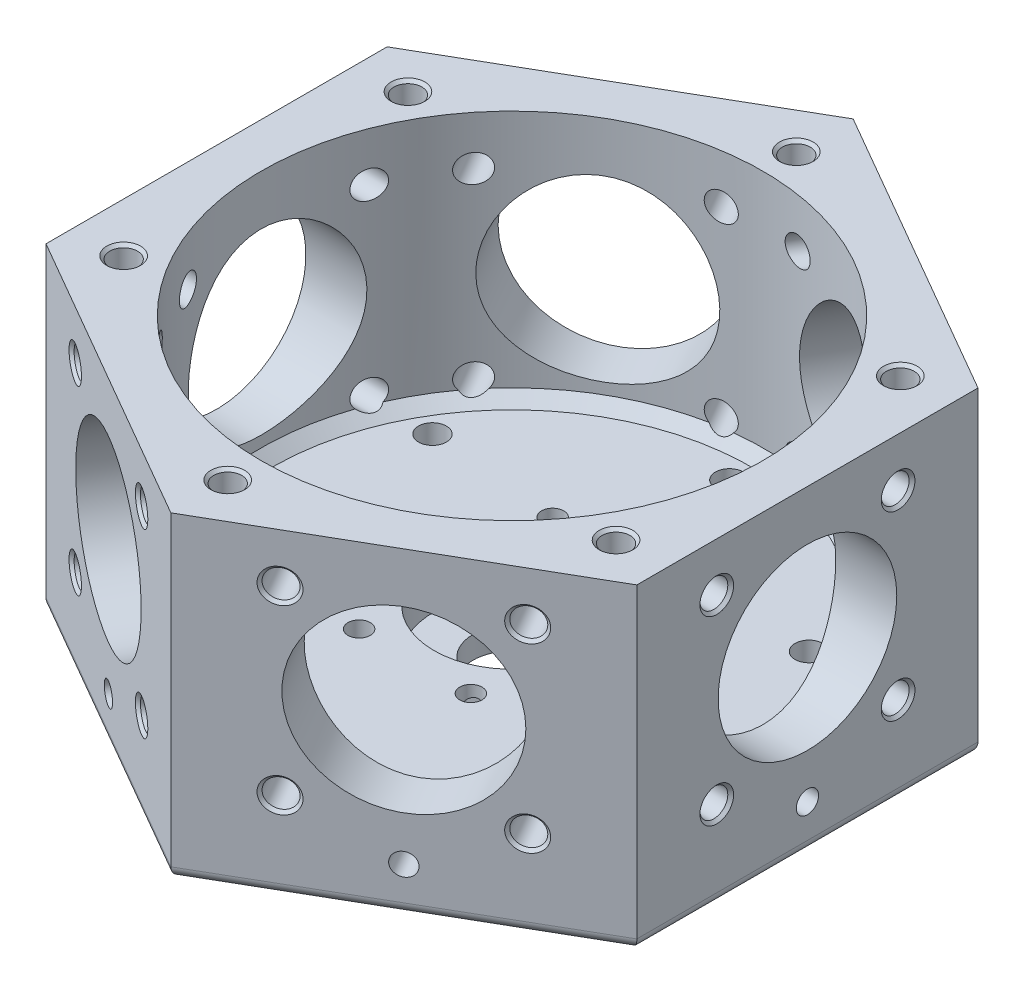
from build123d import *

# Parameters (mm, degrees)
BOSS_EXTRUDE1_DEPTH      = 25
BOSS_EXTRUDE1_DEPTH_BACK = 32
SKETCH2_R                = 45
CUT_EXTRUDE1_DEPTH       = 45
CUT_EXTRUDE2_REACH       = 139.165
CUT_EXTRUDE2_END_RADIUS  = 45
SKETCH5_R                = 16.025
CIRPATTERN1_COUNT        = 6
CHAMFER1_SIZE            = 2
FILLET1_R                = 2
CIRPATTERN2_COUNT        = 6
CIRPATTERN3_COUNT        = 4
CIRPATTERN4_COUNT        = 6
CIRPATTERN5_COUNT        = 6
SKETCH12_R               = 2
CUT_EXTRUDE3_DEPTH       = 100.011783922
CIRPATTERN6_COUNT        = 6
SKETCH13_R               = 2
CUT_EXTRUDE4_DEPTH       = 36
CIRPATTERN7_COUNT        = 6
SKETCH14_R               = 7
CUT_EXTRUDE5_DEPTH       = 100.011783922
SKETCH15_R               = 14
CUT_EXTRUDE6_DEPTH       = 8


with BuildPart() as part:
    # Sketch1 → Boss-Extrude1 (new, two sides: drawn at the far end of the back side and taken through both)
    with BuildSketch(Plane(origin=(0, 0, 0), x_dir=(1, 0, 0), z_dir=(0, 1, 0)).offset(-BOSS_EXTRUDE1_DEPTH_BACK)):
        Polygon((0, -61.199128534), (53, -30.599564267), (53, 30.599564267), (0, 61.199128534), (-53, 30.599564267), (-53, -30.599564267), align=None)
    extrude(amount=BOSS_EXTRUDE1_DEPTH + BOSS_EXTRUDE1_DEPTH_BACK)

    # Sketch2 → Cut-Extrude1 (cut)
    with BuildSketch(Plane(origin=(0, 25, 0), x_dir=(1, 0, 0), z_dir=(0, 1, 0))):
        with Locations(Location((0, 0, 0), (0, 0, 270))):
            Circle(SKETCH2_R)
    extrude(amount=-CUT_EXTRUDE1_DEPTH, mode=Mode.SUBTRACT)

    # Cut-Extrude2: up to this cylinder (the profile starts outside it)
    cut_extrude2_end = Plane(origin=(0, 0, 0), z_dir=(0, 1, 0)) * Cylinder(CUT_EXTRUDE2_END_RADIUS, 369.33, mode=Mode.PRIVATE)
    # Sketch5 → Cut-Extrude2 (cut, up to the surface)
    with BuildSketch(Plane(origin=(-26.5, 0, 45.899346401), x_dir=(0.8660254037844415, 0, 0.4999999999999951), z_dir=(-0.4999999999999951, 0, 0.8660254037844415)), mode=Mode.PRIVATE) as cut_extrude2_sk1:
        Circle(SKETCH5_R)
    cut_extrude2_tool1 = extrude(cut_extrude2_sk1.sketch, amount=-CUT_EXTRUDE2_REACH, mode=Mode.PRIVATE) - cut_extrude2_end
    cut_extrude2 = cut_extrude2_tool1.solids().sort_by_distance((-26.5, 0, 45.899346))[0]
    add(cut_extrude2, mode=Mode.SUBTRACT)

    # CirPattern1: Cut-Extrude2 ×6 about axis
    cirpattern1_axis = Axis((0, 25, 0), (0, 1, 0))
    for i in range(1, CIRPATTERN1_COUNT):
        add(cut_extrude2.rotate(cirpattern1_axis, i * 360 / CIRPATTERN1_COUNT), mode=Mode.SUBTRACT)

    # Chamfer1
    chamfer1_edges = [part.edges().sort_by_distance(p)[0] for p in [
        (0, -20, -45),
    ]]
    chamfer(chamfer1_edges, length=CHAMFER1_SIZE)

    # Fillet1
    fillet1_edges = [part.edges().sort_by_distance(p)[0] for p in [
        (53, -32, 0),
        (26.5, -32, -45.899346401),
        (-26.5, -32, -45.899346401),
        (-53, -32, 0),
        (-26.5, -32, 45.899346401),
        (26.5, -32, 45.899346401),
    ]]
    fillet(fillet1_edges, radius=FILLET1_R)

    # Sketch7 → M6 Tapped Hole1 (revolve, cut)
    with BuildSketch(Plane(origin=(0, 25, -51), x_dir=(0, 0, 1), z_dir=(1, 0, 0))):
        Polygon((0, 0), (0, 13.502151548), (2.5, 12), (2.5, 0.525), (3.025, 0), align=None)
    m6_tapped_hole1 = revolve(axis=Axis((0, 31.35, -51), (0, -1, 0)), mode=Mode.SUBTRACT)

    # CirPattern2: M6 Tapped Hole1 ×6 about axis
    cirpattern2_axis = Axis((0, 0, 0), (0, 1, 0))
    for i in range(1, CIRPATTERN2_COUNT):
        add(m6_tapped_hole1.rotate(cirpattern2_axis, i * 360 / CIRPATTERN2_COUNT), mode=Mode.SUBTRACT)

    # Sketch9 → M6 Tapped Hole2 (revolve, cut)
    with BuildSketch(Plane(origin=(40.584566021, 16.263455967, 37.767618417), x_dir=(0.866025403784438, 0, -0.5000000000000009), z_dir=(0, 1, 0))):
        Polygon((0, 0), (0, 16.502151548), (2.5, 15), (2.5, 0.525), (3.025, 0), align=None)
    m6_tapped_hole2 = revolve(axis=Axis((43.759566021, 16.263455967, 43.266879731), (-0.500000000000001, 0, -0.866025403784438)), mode=Mode.SUBTRACT)

    # CirPattern3: M6 Tapped Hole2 ×4 about axis
    cirpattern3_axis = Axis((0, 0, 0), (0.500000000000001, 0, 0.8660254037844382))
    for i in range(1, CIRPATTERN3_COUNT):
        add(m6_tapped_hole2.rotate(cirpattern3_axis, i * 360 / CIRPATTERN3_COUNT), mode=Mode.SUBTRACT)

    # CirPattern4: M6 Tapped Hole2 ×6 about axis
    cirpattern4_axis = Axis((0, 25, 0), (0, 1, 0))
    for i in range(1, CIRPATTERN4_COUNT):
        add(m6_tapped_hole2.rotate(cirpattern4_axis, i * 360 / CIRPATTERN4_COUNT), mode=Mode.SUBTRACT)

    # CirPattern4 copy 1 sketch → CirPattern4 copy 1 (revolve, cut)
    with BuildSketch(Plane(origin=(53, 16.263455967, 16.263455967), x_dir=(0, 1, 0), z_dir=(0, 0, 1))):
        Polygon((0, 0), (0, 16.502151548), (2.5, 15), (2.5, 0.525), (3.025, 0), align=None)
    revolve(axis=Axis((59.35, 16.263455967, 16.263455967), (-1, 0, 0)), mode=Mode.SUBTRACT)

    # CirPattern4 copy 2 sketch → CirPattern4 copy 2 (revolve, cut)
    with BuildSketch(Plane(origin=(40.584566021, 16.263455967, -37.767618417), x_dir=(0, 1, 0), z_dir=(0.8660254037844392, 0, 0.4999999999999993))):
        Polygon((0, 0), (0, 16.502151548), (2.5, 15), (2.5, 0.525), (3.025, 0), align=None)
    revolve(axis=Axis((43.759566021, 16.263455967, -43.266879731), (-0.4999999999999992, 0, 0.8660254037844393)), mode=Mode.SUBTRACT)

    # CirPattern4 copy 3 sketch → CirPattern4 copy 3 (revolve, cut)
    with BuildSketch(Plane(origin=(-12.415433979, 16.263455967, -54.031074384), x_dir=(0, 1, 0), z_dir=(0.8660254037844383, 0, -0.5000000000000009))):
        Polygon((0, 0), (0, 16.502151548), (2.5, 15), (2.5, 0.525), (3.025, 0), align=None)
    revolve(axis=Axis((-15.590433979, 16.263455967, -59.530335698), (0.5000000000000009, 0, 0.8660254037844382)), mode=Mode.SUBTRACT)

    # CirPattern4 copy 4 sketch → CirPattern4 copy 4 (revolve, cut)
    with BuildSketch(Plane(origin=(-53, 16.263455967, -16.263455967), x_dir=(0, 1, 0), z_dir=(0, 0, -1))):
        Polygon((0, 0), (0, 16.502151548), (2.5, 15), (2.5, 0.525), (3.025, 0), align=None)
    revolve(axis=Axis((-59.35, 16.263455967, -16.263455967), (1, 0, 0)), mode=Mode.SUBTRACT)

    # CirPattern4 copy 5 sketch → CirPattern4 copy 5 (revolve, cut)
    with BuildSketch(Plane(origin=(-40.584566021, 16.263455967, 37.767618417), x_dir=(0, 1, 0), z_dir=(-0.8660254037844394, 0, -0.499999999999999))):
        Polygon((0, 0), (0, 16.502151548), (2.5, 15), (2.5, 0.525), (3.025, 0), align=None)
    revolve(axis=Axis((-43.759566021, 16.263455967, 43.266879731), (0.499999999999999, 0, -0.8660254037844394)), mode=Mode.SUBTRACT)

    # CirPattern4 copy 6 sketch → CirPattern4 copy 6 (revolve, cut)
    with BuildSketch(Plane(origin=(53, -16.263455967, 16.263455967), x_dir=(0, 0, 1), z_dir=(0, -1, 0))):
        Polygon((0, 0), (0, 16.502151548), (2.5, 15), (2.5, 0.525), (3.025, 0), align=None)
    revolve(axis=Axis((59.35, -16.263455967, 16.263455967), (-1, 0, 0)), mode=Mode.SUBTRACT)

    # CirPattern4 copy 7 sketch → CirPattern4 copy 7 (revolve, cut)
    with BuildSketch(Plane(origin=(40.584566021, -16.263455967, -37.767618417), x_dir=(0.866025403784439, 0, 0.499999999999999), z_dir=(0, -1, 0))):
        Polygon((0, 0), (0, 16.502151548), (2.5, 15), (2.5, 0.525), (3.025, 0), align=None)
    revolve(axis=Axis((43.759566021, -16.263455967, -43.266879731), (-0.4999999999999993, 0, 0.8660254037844392)), mode=Mode.SUBTRACT)

    # CirPattern4 copy 8 sketch → CirPattern4 copy 8 (revolve, cut)
    with BuildSketch(Plane(origin=(-12.415433979, -16.263455967, -54.031074384), x_dir=(0.8660254037844382, 0, -0.5000000000000009), z_dir=(0, -1, 0))):
        Polygon((0, 0), (0, 16.502151548), (2.5, 15), (2.5, 0.525), (3.025, 0), align=None)
    revolve(axis=Axis((-15.590433979, -16.263455967, -59.530335698), (0.5000000000000009, 0, 0.8660254037844384)), mode=Mode.SUBTRACT)

    # CirPattern4 copy 9 sketch → CirPattern4 copy 9 (revolve, cut)
    with BuildSketch(Plane(origin=(-53, -16.263455967, -16.263455967), x_dir=(0, 0, -1), z_dir=(0, -1, 0))):
        Polygon((0, 0), (0, 16.502151548), (2.5, 15), (2.5, 0.525), (3.025, 0), align=None)
    revolve(axis=Axis((-59.35, -16.263455967, -16.263455967), (1, 0, 0)), mode=Mode.SUBTRACT)

    # CirPattern4 copy 10 sketch → CirPattern4 copy 10 (revolve, cut)
    with BuildSketch(Plane(origin=(-40.584566021, -16.263455967, 37.767618417), x_dir=(-0.8660254037844395, 0, -0.49999999999999883), z_dir=(0, -1, 0))):
        Polygon((0, 0), (0, 16.502151548), (2.5, 15), (2.5, 0.525), (3.025, 0), align=None)
    revolve(axis=Axis((-43.759566021, -16.263455967, 43.266879731), (0.4999999999999991, 0, -0.8660254037844395)), mode=Mode.SUBTRACT)

    # CirPattern4 copy 11 sketch → CirPattern4 copy 11 (revolve, cut)
    with BuildSketch(Plane(origin=(53, -16.263455967, -16.263455967), x_dir=(0, -1, 0), z_dir=(0, 0, -1))):
        Polygon((0, 0), (0, 16.502151548), (2.5, 15), (2.5, 0.525), (3.025, 0), align=None)
    revolve(axis=Axis((59.35, -16.263455967, -16.263455967), (-1, 0, 0)), mode=Mode.SUBTRACT)

    # CirPattern4 copy 12 sketch → CirPattern4 copy 12 (revolve, cut)
    with BuildSketch(Plane(origin=(12.415433979, -16.263455967, -54.031074384), x_dir=(0, -1, 0), z_dir=(-0.8660254037844392, 0, -0.4999999999999993))):
        Polygon((0, 0), (0, 16.502151548), (2.5, 15), (2.5, 0.525), (3.025, 0), align=None)
    revolve(axis=Axis((15.590433979, -16.263455967, -59.530335698), (-0.49999999999999917, 0, 0.8660254037844393)), mode=Mode.SUBTRACT)

    # CirPattern4 copy 13 sketch → CirPattern4 copy 13 (revolve, cut)
    with BuildSketch(Plane(origin=(-40.584566021, -16.263455967, -37.767618417), x_dir=(0, -1, 0), z_dir=(-0.8660254037844383, 0, 0.5000000000000009))):
        Polygon((0, 0), (0, 16.502151548), (2.5, 15), (2.5, 0.525), (3.025, 0), align=None)
    revolve(axis=Axis((-43.759566021, -16.263455967, -43.266879731), (0.5000000000000009, 0, 0.8660254037844382)), mode=Mode.SUBTRACT)

    # CirPattern4 copy 14 sketch → CirPattern4 copy 14 (revolve, cut)
    with BuildSketch(Plane(origin=(-53, -16.263455967, 16.263455967), x_dir=(0, -1, 0), z_dir=(0, 0, 1))):
        Polygon((0, 0), (0, 16.502151548), (2.5, 15), (2.5, 0.525), (3.025, 0), align=None)
    revolve(axis=Axis((-59.35, -16.263455967, 16.263455967), (1, 0, 0)), mode=Mode.SUBTRACT)

    # CirPattern4 copy 15 sketch → CirPattern4 copy 15 (revolve, cut)
    with BuildSketch(Plane(origin=(-12.415433979, -16.263455967, 54.031074384), x_dir=(0, -1, 0), z_dir=(0.8660254037844394, 0, 0.499999999999999))):
        Polygon((0, 0), (0, 16.502151548), (2.5, 15), (2.5, 0.525), (3.025, 0), align=None)
    revolve(axis=Axis((-15.590433979, -16.263455967, 59.530335698), (0.4999999999999989, 0, -0.8660254037844394)), mode=Mode.SUBTRACT)

    # Sketch11 → M6 Tapped Hole3 (revolve, cut)
    with BuildSketch(Plane(origin=(0, -32, 39), x_dir=(0, 0, -1), z_dir=(1, 0, 0))):
        Polygon((0, 0), (0, 16.502151548), (2.5, 15), (2.5, 0.525), (3.025, 0), align=None)
    m6_tapped_hole3 = revolve(axis=Axis((0, -38.35, 39), (0, 1, 0)), mode=Mode.SUBTRACT)

    # CirPattern5: M6 Tapped Hole3 ×6 about axis
    cirpattern5_axis = Axis((0, 0, 0), (0, 1, 0))
    for i in range(1, CIRPATTERN5_COUNT):
        add(m6_tapped_hole3.rotate(cirpattern5_axis, i * 360 / CIRPATTERN5_COUNT), mode=Mode.SUBTRACT)

    # Sketch12 → Cut-Extrude3 (cut, through all)
    with BuildSketch(Plane.XZ.offset(32)):
        with Locations(Location((20, 0, 0), (0, 0, 270))):
            Circle(SKETCH12_R)
    cut_extrude3 = extrude(amount=-CUT_EXTRUDE3_DEPTH, mode=Mode.SUBTRACT)

    # CirPattern6: Cut-Extrude3 ×6 about axis
    cirpattern6_axis = Axis((-0.044260028, 0, 0), (0, 1, 0))
    for i in range(1, CIRPATTERN6_COUNT):
        add(cut_extrude3.rotate(cirpattern6_axis, i * 360 / CIRPATTERN6_COUNT), mode=Mode.SUBTRACT)

    # Sketch13 → Cut-Extrude4 (cut)
    with BuildSketch(Plane(origin=(53, 0, 0), x_dir=(0, 0, -1), z_dir=(1, 0, 0))):
        with Locations((0, -24)):
            Circle(SKETCH13_R)
    cut_extrude4 = extrude(amount=-CUT_EXTRUDE4_DEPTH, mode=Mode.SUBTRACT)

    # CirPattern7: Cut-Extrude4 ×6 about axis
    cirpattern7_axis = Axis((0, 0, 0), (0, 1, 0))
    for i in range(1, CIRPATTERN7_COUNT):
        add(cut_extrude4.rotate(cirpattern7_axis, i * 360 / CIRPATTERN7_COUNT), mode=Mode.SUBTRACT)

    # Sketch14 → Cut-Extrude5 (cut, through all)
    with BuildSketch(Plane.XZ.offset(32)):
        with Locations(Location((0, 0, 0), (0, 0, 270))):
            Circle(SKETCH14_R)
    extrude(amount=-CUT_EXTRUDE5_DEPTH, mode=Mode.SUBTRACT)

    # Sketch15 → Cut-Extrude6 (cut)
    with BuildSketch(Plane(origin=(0, -20, 0), x_dir=(1, 0, 0), z_dir=(0, 1, 0))):
        with Locations(Location((0, 0, 0), (0, 0, 270))):
            Circle(SKETCH15_R)
    extrude(amount=-CUT_EXTRUDE6_DEPTH, mode=Mode.SUBTRACT)


solid = part.part
